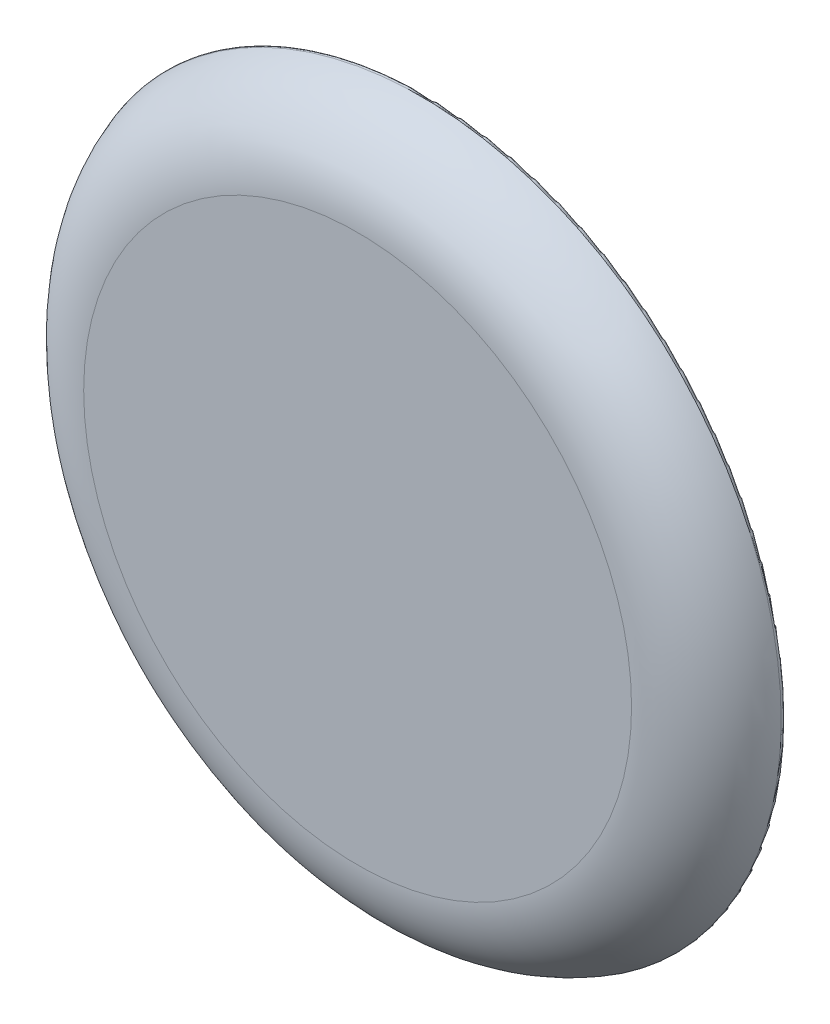
from build123d import *

# Parameters (mm, degrees)
SKETCH1_R           = 16
BOSS_EXTRUDE1_DEPTH = 3
FILLET1_R           = 4
FILLET2_R           = 0.15
SKETCH2_R           = 11.05
SKETCH2_R_2         = 7.75
BOSS_EXTRUDE2_DEPTH = 2
FILLET3_R           = 0.25


with BuildPart() as part:
    # Sketch1 → Boss-Extrude1 (new body)
    with BuildSketch(Plane.XY):
        with Locations((-86.26466932, 57.470508952)):
            Circle(SKETCH1_R)
    extrude(amount=BOSS_EXTRUDE1_DEPTH)

    # Fillet1
    # the kernel refuses this fillet: 4 mm, written as the material it takes off along each edge
    with BuildSketch(Plane(origin=(-86.26466932, 57.470508952, 3), x_dir=(1, 0, 0), z_dir=(0, -1, 0))) as fillet1_piece_1:
        with BuildLine():
            CenterArc((12.127016654, -4), FILLET1_R, 14.477512186, 75.522487814)
            Line((12.127016654, 0), (12.127016654, 0.08))
            Line((12.127016654, 0.08), (16, 0.08))
            Line((16, 0.08), (16.08, 0))
            ThreePointArc((16.08, 0), (16.08, -1.5), (16.077459667, -2.98))
            Line((16.077459667, -2.98), (16, -3))
        make_face()
    revolve(axis=Axis((-86.26466932, 57.470508952, 3), (0, 0, 1)), mode=Mode.SUBTRACT)

    # Fillet2
    fillet2_edges = [part.edges().sort_by_distance(p)[0] for p in [
        (-102.26466932, 57.470508952, 0),
    ]]
    fillet(fillet2_edges, radius=FILLET2_R)

    # Sketch2 → Boss-Extrude2 (add)
    with BuildSketch(Plane(origin=(0, 0, 0), x_dir=(-1, 0, 0), z_dir=(0, 0, -1))):
        with Locations(Location((86.26466932, 57.470508952, 0), (0, 0, 180))):
            Circle(SKETCH2_R)
        with Locations((86.26466932, 57.470508952)):
            Circle(SKETCH2_R_2, mode=Mode.SUBTRACT)
    extrude(amount=BOSS_EXTRUDE2_DEPTH)

    # Fillet3
    fillet3_edges = [part.edges().sort_by_distance(p)[0] for p in [
        (-97.31466932, 57.470508952, -2),
    ]]
    fillet(fillet3_edges, radius=FILLET3_R)


solid = part.part
